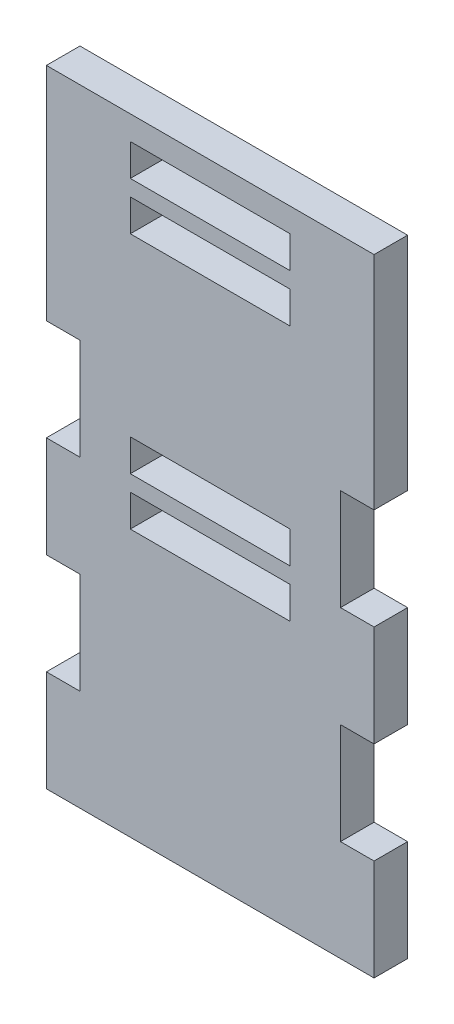
from build123d import *

# Parameters (mm, degrees)
SKETCH1_W           = 52.07
SKETCH1_H           = 80.518
BOSS_EXTRUDE1_DEPTH = 5.334
SKETCH2_W           = 5.334
SKETCH2_H           = 16.1036
CUT_EXTRUDE1_DEPTH  = 57.679185374
SKETCH4_W           = 52.07
SKETCH4_H           = 35.1536
BOSS_EXTRUDE2_DEPTH = 5.334
SKETCH5_W           = 25.4
SKETCH5_H           = 5.08
CUT_EXTRUDE5_DEPTH  = 72.631709324


with BuildPart() as part:
    # Sketch1 → Boss-Extrude1 (new body)
    with BuildSketch(Plane.XY):
        with Locations((-12.912278732, 0.572213281)):
            Rectangle(SKETCH1_W, SKETCH1_H)
    extrude(amount=BOSS_EXTRUDE1_DEPTH)

    # Sketch2 → Cut-Extrude1 (cut, through all)
    with BuildSketch(Plane.XY.offset(5.334)):
        with Locations((-36.280278732, 16.675813281)):
            Rectangle(SKETCH2_W, SKETCH2_H)
        with Locations((-36.280278732, -15.531386719)):
            Rectangle(SKETCH2_W, SKETCH2_H)
        with Locations((10.455721268, -15.531386719)):
            Rectangle(SKETCH2_W, SKETCH2_H)
        with Locations((10.455721268, 16.675813281)):
            Rectangle(SKETCH2_W, SKETCH2_H)
    extrude(amount=-CUT_EXTRUDE1_DEPTH, mode=Mode.SUBTRACT)

    # Sketch4 → Boss-Extrude2 (add)
    with BuildSketch(Plane.XY.offset(5.334)):
        with Locations((-12.912278732, 42.304413281)):
            Rectangle(SKETCH4_W, SKETCH4_H)
    extrude(amount=-BOSS_EXTRUDE2_DEPTH)

    # Sketch5 → Cut-Extrude5 (cut, through all)
    with BuildSketch(Plane.XY.offset(5.334)):
        with Locations((-12.912278732, 12.891213281)):
            Rectangle(SKETCH5_W, SKETCH5_H)
        with Locations((-12.912278732, 53.531213281)):
            Rectangle(SKETCH5_W, SKETCH5_H)
        with Locations((-12.912278732, 45.911213281)):
            Rectangle(SKETCH5_W, SKETCH5_H)
        with Locations((-12.912278732, 5.271213281)):
            Rectangle(SKETCH5_W, SKETCH5_H)
    extrude(amount=-CUT_EXTRUDE5_DEPTH, mode=Mode.SUBTRACT)


solid = part.part
